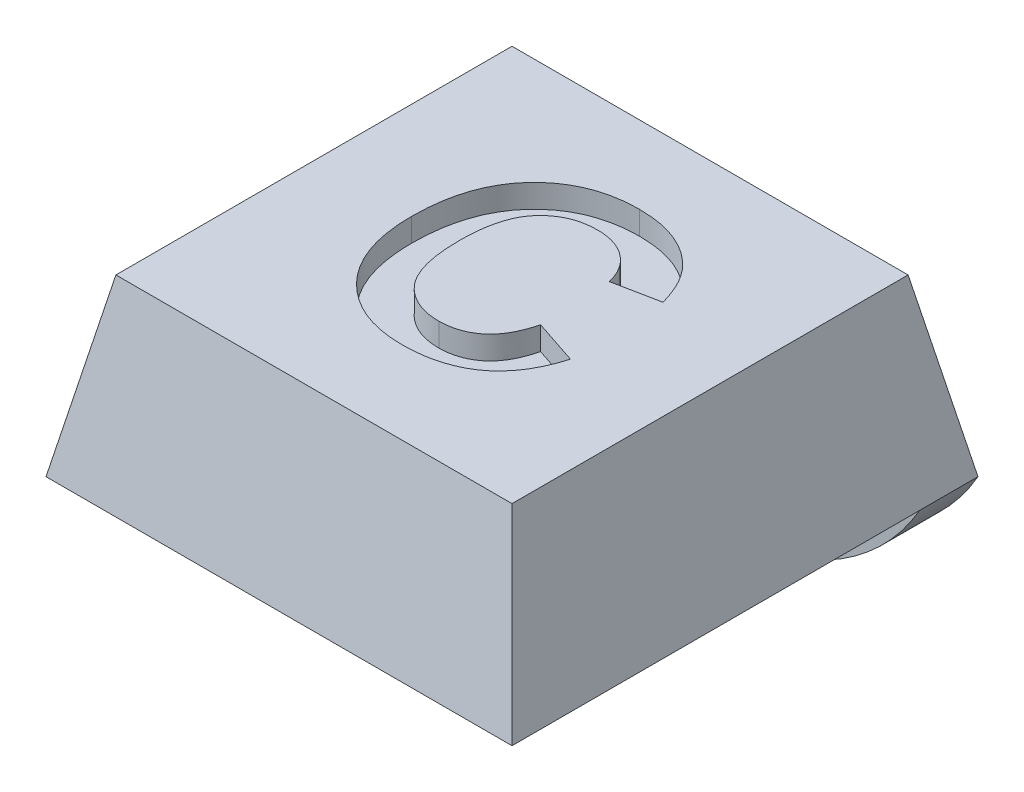
from build123d import *

# Parameters (mm, degrees)
SKETCH1_W               = 8
SKETCH1_H               = 8
BOSS_EXTRUDE1_DEPTH     = 3
CUT_EXTRUDE1_DEPTH      = 12.704699911
CUT_EXTRUDE1_DEPTH_BACK = 12.704699911
CUT_EXTRUDE2_DEPTH      = 11
SKETCH4_R               = 1.75
CUT_EXTRUDE3_DEPTH      = 0.4
SKETCH5_W               = 8
SKETCH5_H               = 1
BOSS_EXTRUDE2_DEPTH     = 2
FILLET1_R               = 4
CUT_EXTRUDE4_DEPTH      = 0.4


with BuildPart() as part:
    # Sketch1 → Boss-Extrude1 (new body)
    with BuildSketch(Plane(origin=(0, 0, 0), x_dir=(1, 0, 0), z_dir=(0, 1, 0))):
        with Locations((4, 4)):
            Rectangle(SKETCH1_W, SKETCH1_H)
    extrude(amount=BOSS_EXTRUDE1_DEPTH)

    # Sketch2 → Cut-Extrude1 (cut, two sides: drawn at the far end of the back side and taken through both)
    with BuildSketch(Plane.XY.offset(-CUT_EXTRUDE1_DEPTH_BACK)):
        Polygon((0, 0), (0.6, 3), (0, 3), align=None)
        Polygon((8, 0), (7.4, 3), (8, 3), align=None)
    extrude(amount=CUT_EXTRUDE1_DEPTH + CUT_EXTRUDE1_DEPTH_BACK, mode=Mode.SUBTRACT)

    # Sketch3 → Cut-Extrude2 (cut)
    with BuildSketch(Plane(origin=(0, 0, 0), x_dir=(0, 0, -1), z_dir=(1, 0, 0))):
        Polygon((0, 0), (0.6, 3), (0, 3), align=None)
        Polygon((8, 3), (7.4, 3), (8, 0), align=None)
    extrude(amount=CUT_EXTRUDE2_DEPTH, mode=Mode.SUBTRACT)

    # Sketch4 → Cut-Extrude3 (cut)
    with BuildSketch(Plane.XZ):
        with Locations(Location((4, -3.75, 0), (0, 0, 270))):
            Circle(SKETCH4_R)
    extrude(amount=-CUT_EXTRUDE3_DEPTH, mode=Mode.SUBTRACT)

    # Sketch5 → Boss-Extrude2 (add)
    with BuildSketch(Plane.XZ):
        with Locations((4, -7.5)):
            Rectangle(SKETCH5_W, SKETCH5_H)
    extrude(amount=BOSS_EXTRUDE2_DEPTH)

    # Fillet1
    # the kernel refuses this fillet: 4 mm, written as the material it takes off along each edge
    with BuildSketch(Plane(origin=(8, -2, -16.660254038), x_dir=(0, 1, 0), z_dir=(0, 0, 1)), Plane(origin=(0, -2, 1.660254038), x_dir=(0, 1, 0), z_dir=(0, 0, -1))) as fillet1_piece_1:
        with BuildLine():
            CenterArc((4, 3.464101615), FILLET1_R, 180, 60)
            Line((0, 3.464101615), (-0.08, 3.464101615))
            Line((-0.08, 3.464101615), (-0.08, 0))
            Line((-0.08, 0), (0, -0.08))
            ThreePointArc((0, -0.08), (1, -0.08), (1.96, -0.069282032))
            Line((1.96, -0.069282032), (2, 0))
        make_face()
    extrude(amount=18.320508076, mode=Mode.SUBTRACT)

    # Sketch6 → Cut-Extrude4 (cut)
    with BuildSketch(Plane(origin=(0, 3, 0), x_dir=(1, 0, 0), z_dir=(0, 1, 0))):
        with BuildLine():
            Line((4.984953699, 3.505457585), (5.754184468, 3.249047329))
            add(Edge.make_bspline(
                [(5.754184468, 3.249047329), (5.738551331, 3.198610805), (5.707936732, 3.099840225), (5.651723194, 2.958278532), (5.587443886, 2.827086856), (5.517410433, 2.704729688), (5.437267593, 2.594367909), (5.351502188, 2.492347505), (5.25756407, 2.400817223), (5.155916755, 2.319581611), (5.047538657, 2.247743191), (4.931170847, 2.187011676), (4.808549951, 2.134705195), (4.678432524, 2.092325917), (4.541682112, 2.058386549), (4.397657073, 2.035969411), (4.247031142, 2.020769852), (4.144181592, 2.01912185), (4.091524212, 2.018278098)],
                knots=[0, 0, 0, 0, 1.126640671, 2.206316847, 3.246446654, 4.24268115, 5.210795778, 6.153057602, 7.084219323, 8.004711971, 8.926421631, 9.854560063, 10.802134612, 11.768317461, 12.772025444, 13.805668576, 14.876536225, 16, 16, 16, 16], degree=3))
            add(Edge.make_bspline(
                [(4.091524212, 2.018278098), (4.026529436, 2.019622049), (3.898682769, 2.022265641), (3.711719127, 2.048877042), (3.533551231, 2.090397174), (3.363924198, 2.147881075), (3.203970267, 2.224018355), (3.052230113, 2.31567777), (2.909808045, 2.424720155), (2.777203704, 2.549307725), (2.656729454, 2.688489389), (2.552550394, 2.841513049), (2.46353299, 3.006222974), (2.391584534, 3.18340452), (2.335325697, 3.372875751), (2.295916265, 3.574374695), (2.271256348, 3.787964822), (2.268446864, 3.934340923), (2.267004981, 4.009463995)],
                knots=[0, 0, 0, 0, 1.025049111, 2.016302254, 2.973197159, 3.90886983, 4.83646737, 5.763135642, 6.70136783, 7.661478232, 8.629732022, 9.600038443, 10.576877021, 11.5787097, 12.612181225, 13.690866959, 14.814907849, 16, 16, 16, 16], degree=3))
            add(Edge.make_bspline(
                [(2.267004981, 4.009463995), (2.268440364, 4.088592426), (2.271240535, 4.242957555), (2.295946649, 4.467391238), (2.33430142, 4.6789069), (2.390655342, 4.87619306), (2.461546504, 5.060638151), (2.550671985, 5.230411199), (2.653811862, 5.387775744), (2.773739341, 5.529847487), (2.90694801, 5.655987983), (3.049697575, 5.767530284), (3.203319761, 5.861106277), (3.366973913, 5.937627827), (3.540879519, 5.996843969), (3.724694381, 6.039484239), (3.918568892, 6.064303618), (4.051121857, 6.067784001), (4.118767802, 6.069560149)],
                knots=[0, 0, 0, 0, 1.212648312, 2.365655595, 3.457000981, 4.504219827, 5.506356588, 6.480637568, 7.437950897, 8.385265166, 9.323599949, 10.245787653, 11.157260172, 12.074946661, 13.00980897, 13.968233668, 14.963125779, 16, 16, 16, 16], degree=3))
            add(Edge.make_bspline(
                [(4.118767802, 6.069560149), (4.177845619, 6.068071541), (4.293675542, 6.065152928), (4.463296702, 6.045323759), (4.624050093, 6.010524892), (4.776804639, 5.963554159), (4.920690778, 5.901565287), (5.05596628, 5.825815524), (5.18309612, 5.736705664), (5.259694467, 5.667100309), (5.298254981, 5.632060149)],
                knots=[0, 0, 0, 0, 1.098510076, 2.153775193, 3.169777012, 4.153122333, 5.120892526, 6.076995459, 7.031936742, 8, 8, 8, 8], degree=3))
            add(Edge.make_bspline(
                [(5.298254981, 5.632060149), (5.320604149, 5.60976374), (5.365827451, 5.564647194), (5.426213252, 5.488477681), (5.483466493, 5.406481188), (5.536678451, 5.317258958), (5.58416733, 5.220136739), (5.628218337, 5.11660602), (5.668774447, 5.006267724), (5.691328308, 4.929479087), (5.702902417, 4.89007297)],
                knots=[0, 0, 0, 0, 0.885292881, 1.791380647, 2.722937556, 3.69093542, 4.703306561, 5.754477758, 6.847650944, 8, 8, 8, 8], degree=3))
            Line((5.702902417, 4.89007297), (4.933671648, 4.736226816))
            add(Edge.make_bspline(
                [(4.933671648, 4.736226816), (4.927133502, 4.76145763), (4.914255072, 4.811155713), (4.888197319, 4.88256913), (4.858307022, 4.950334085), (4.821260737, 5.012790777), (4.781908002, 5.072717729), (4.735316585, 5.127453998), (4.684461977, 5.178434101), (4.62897783, 5.22512899), (4.569525593, 5.266595122), (4.507249934, 5.303870591), (4.441018967, 5.334299022), (4.371713727, 5.358915551), (4.29961025, 5.379554656), (4.224066596, 5.392304393), (4.145731594, 5.40209207), (4.092359182, 5.40262243), (4.065081904, 5.402893482)],
                knots=[0, 0, 0, 0, 1.051226935, 2.070641259, 3.064374968, 4.034983734, 4.997599858, 5.953980297, 6.92954377, 7.901109626, 8.875958313, 9.851998019, 10.826131395, 11.811470594, 12.818270757, 13.847890818, 14.900111925, 16, 16, 16, 16], degree=3))
            add(Edge.make_bspline(
                [(4.065081904, 5.402893482), (4.027621622, 5.402136956), (3.95451036, 5.400660441), (3.84764705, 5.384198307), (3.745794169, 5.361223694), (3.649362485, 5.32614158), (3.558949174, 5.281271846), (3.473526684, 5.226727667), (3.393563858, 5.162742669), (3.319033671, 5.088558841), (3.252152959, 5.002834902), (3.193355266, 4.905393862), (3.144577309, 4.795129453), (3.104977365, 4.673123713), (3.073807698, 4.539086512), (3.051550102, 4.39284594), (3.039240982, 4.234301954), (3.037259111, 4.124602201), (3.03623575, 4.067957585)],
                knots=[0, 0, 0, 0, 0.938194206, 1.831074359, 2.704771284, 3.551924377, 4.396294915, 5.230222094, 6.087631332, 6.958733431, 7.860107878, 8.806247581, 9.804197948, 10.875520245, 12.017191412, 13.250061517, 14.580040491, 16, 16, 16, 16], degree=3))
            add(Edge.make_bspline(
                [(3.03623575, 4.067957585), (3.037249034, 4.007841988), (3.039201475, 3.892008492), (3.051507983, 3.724929387), (3.073907907, 3.571260811), (3.104663329, 3.430730056), (3.144462832, 3.303423199), (3.1931583, 3.189560541), (3.251047919, 3.089008738), (3.318041624, 3.001834743), (3.3924457, 2.926952551), (3.472244969, 2.862570915), (3.55696863, 2.80752487), (3.647126515, 2.762236533), (3.743061533, 2.72797641), (3.843985242, 2.703130369), (3.950267946, 2.687335345), (4.023091528, 2.685752793), (4.060274212, 2.684944765)],
                knots=[0, 0, 0, 0, 1.475208372, 2.842499301, 4.107722225, 5.282836115, 6.369007568, 7.375918121, 8.315702116, 9.208439171, 10.065831443, 10.90006451, 11.71996243, 12.54067204, 13.369972975, 14.214060185, 15.088124569, 16, 16, 16, 16], degree=3))
            add(Edge.make_bspline(
                [(4.060274212, 2.684944765), (4.087802914, 2.685631562), (4.141934021, 2.686982048), (4.22194397, 2.695553476), (4.298737204, 2.711910812), (4.3726896, 2.733540427), (4.444088489, 2.760679214), (4.511844803, 2.795492821), (4.577291618, 2.835505891), (4.639070965, 2.882398144), (4.6980101, 2.93504365), (4.751766089, 2.995888735), (4.801629231, 3.063471428), (4.846966938, 3.138243387), (4.889294086, 3.219564589), (4.92530624, 3.308702064), (4.958854788, 3.404215308), (4.976102112, 3.471120718), (4.984953699, 3.505457585)],
                knots=[0, 0, 0, 0, 0.980177776, 1.927374078, 2.859849964, 3.771585772, 4.668674471, 5.574490016, 6.479656464, 7.396337719, 8.332153134, 9.288470092, 10.28125149, 11.318486971, 12.398724812, 13.541284404, 14.738150009, 16, 16, 16, 16], degree=3))
        make_face()
    extrude(amount=-CUT_EXTRUDE4_DEPTH, mode=Mode.SUBTRACT)


solid = part.part
